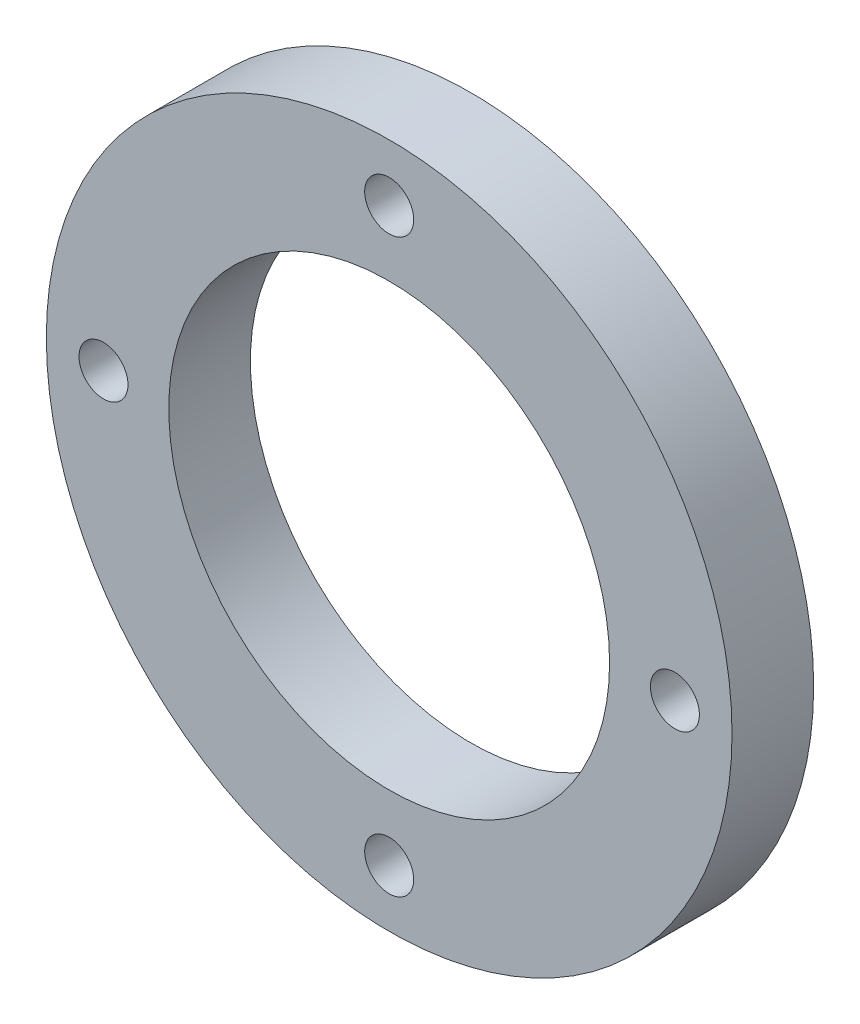
from build123d import *

# Parameters (mm, degrees)
SKETCH1_R           = 21
SKETCH1_R_2         = 13
SKETCH1_R_3         = 1.5
BOSS_EXTRUDE1_DEPTH = 5
SKETCH2_R           = 13.5
CUT_EXTRUDE1_DEPTH  = 10


with BuildPart() as part:
    # Sketch1 → Boss-Extrude1 (new body)
    with BuildSketch(Plane.XY):
        with Locations((49, 5)):
            Circle(SKETCH1_R)
        with Locations((49, 5)):
            Circle(SKETCH1_R_2, mode=Mode.SUBTRACT)
        with Locations((31.5, 5)):
            Circle(SKETCH1_R_3, mode=Mode.SUBTRACT)
        with Locations((49, 22.5)):
            Circle(SKETCH1_R_3, mode=Mode.SUBTRACT)
        with Locations((66.5, 5)):
            Circle(SKETCH1_R_3, mode=Mode.SUBTRACT)
        with Locations((49, -12.5)):
            Circle(SKETCH1_R_3, mode=Mode.SUBTRACT)
    extrude(amount=BOSS_EXTRUDE1_DEPTH)

    # Sketch2 → Cut-Extrude1 (cut)
    with BuildSketch(Plane.XY.offset(5)):
        with Locations((49, 5)):
            Circle(SKETCH2_R)
    extrude(amount=-CUT_EXTRUDE1_DEPTH, mode=Mode.SUBTRACT)


solid = part.part
